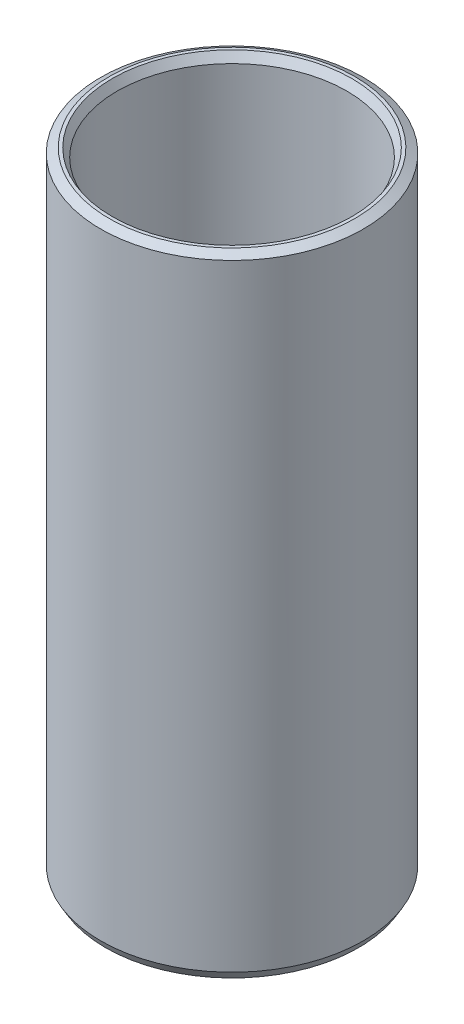
from build123d import *
from OCP.BRepFilletAPI import BRepFilletAPI_MakeChamfer

# Parameters (mm, degrees)
SKETCH1_R           = 37.5
BOSS_EXTRUDE1_DEPTH = 179.743611509
SKETCH2_R           = 32.778910927
CUT_EXTRUDE1_DEPTH  = 188.404017775
CHAMFER1_SIZE       = 1.394228288
CHAMFER1_SIZE2      = 2.414874232


with BuildPart() as part:
    # Sketch1 → Boss-Extrude1 (new body)
    with BuildSketch(Plane(origin=(0, 0, 0), x_dir=(1, 0, 0), z_dir=(0, 1, 0))):
        Circle(SKETCH1_R)
    extrude(amount=BOSS_EXTRUDE1_DEPTH)

    # Sketch2 → Cut-Extrude1 (cut, through all)
    with BuildSketch(Plane(origin=(0, 0, 0), x_dir=(1, 0, 0), z_dir=(0, 1, 0))):
        Circle(SKETCH2_R)
    extrude(amount=CUT_EXTRUDE1_DEPTH, mode=Mode.SUBTRACT)

    # Chamfer1: one chamfer whose edges measure the first distance from different faces: ONE call of the kernel's chamfer builder (chamfer() names one face for all edges)
    chamfer1_edges_1 = [part.edges().sort_by_distance(p)[0] for p in [
        (-32.778910927, 179.743611509, 0),
    ]]
    chamfer1_side_1 = [part.faces().sort_by_distance(p)[0] for p in [
        (-36.439339828, 179.743611509, 0),
    ]]
    chamfer1_edges_2 = [part.edges().sort_by_distance(p)[0] for p in [
        (-32.778910927, 0, 0),
    ]]
    chamfer1_side_2 = [part.faces().sort_by_distance(p)[0] for p in [
        (-32.778910927, 89.871805755, 0),
    ]]
    chamfer1_edges_3 = [part.edges().sort_by_distance(p)[0] for p in [
        (-37.5, 0, 0),
    ]]
    chamfer1_side_3 = [part.faces().sort_by_distance(p)[0] for p in [
        (-36.439339828, 0, 0),
    ]]
    chamfer1_edges_4 = [part.edges().sort_by_distance(p)[0] for p in [
        (-37.5, 179.743611509, 0),
    ]]
    chamfer1_side_4 = [part.faces().sort_by_distance(p)[0] for p in [
        (-37.5, 89.871805755, 0),
    ]]
    chamfer1 = BRepFilletAPI_MakeChamfer(part.part.solid().wrapped)
    for e in chamfer1_edges_1:
        chamfer1.Add(CHAMFER1_SIZE, CHAMFER1_SIZE2, e.wrapped, chamfer1_side_1[0].wrapped)  # the first distance lies on this face
    for e in chamfer1_edges_2:
        chamfer1.Add(CHAMFER1_SIZE, CHAMFER1_SIZE2, e.wrapped, chamfer1_side_2[0].wrapped)  # the first distance lies on this face
    for e in chamfer1_edges_3:
        chamfer1.Add(CHAMFER1_SIZE, CHAMFER1_SIZE2, e.wrapped, chamfer1_side_3[0].wrapped)  # the first distance lies on this face
    for e in chamfer1_edges_4:
        chamfer1.Add(CHAMFER1_SIZE, CHAMFER1_SIZE2, e.wrapped, chamfer1_side_4[0].wrapped)  # the first distance lies on this face
    add(Compound.cast(chamfer1.Shape()), mode=Mode.REPLACE)


solid = part.part
